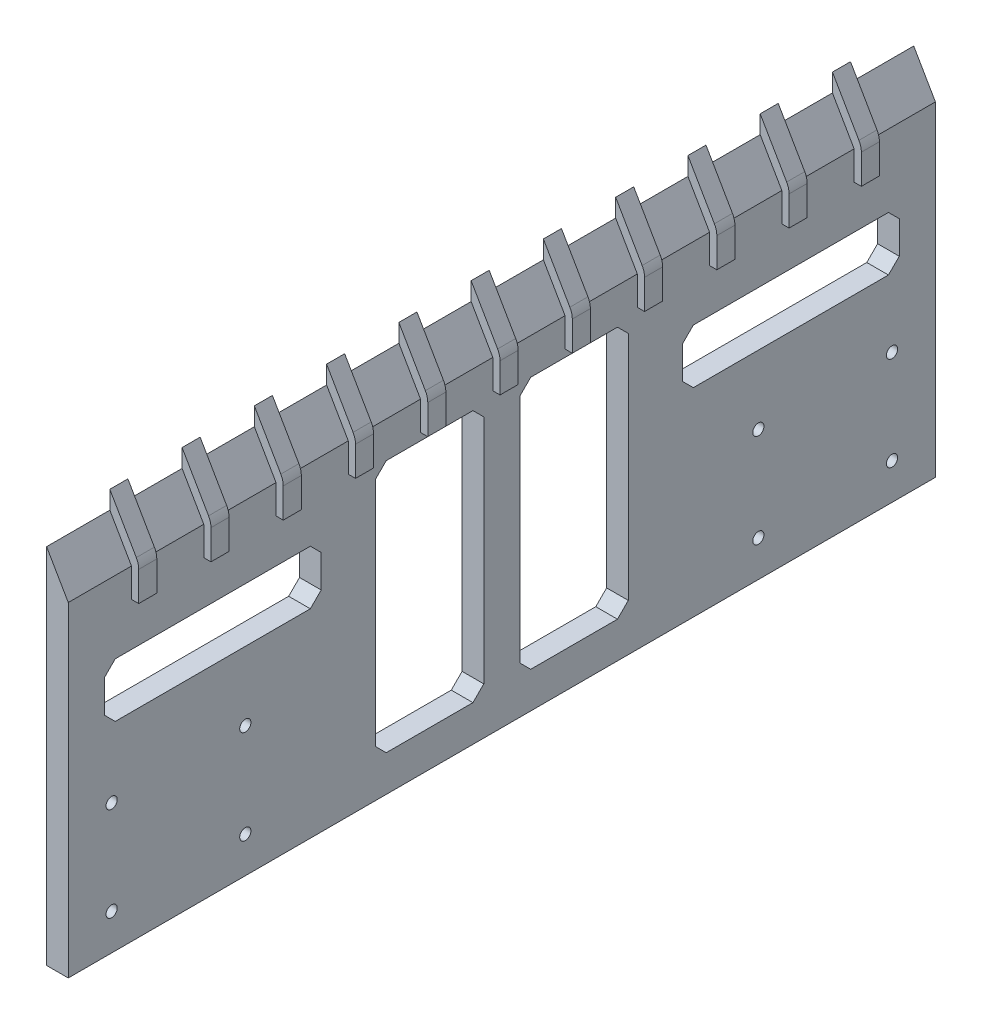
from build123d import *

# Parameters (mm, degrees)
SKETCH_1_W                  = 240
SKETCH_1_H                  = 90
EXTRUDE_1_DEPTH             = 6
SKETCH_2_R                  = 1.55
CUT_EXTRUDE_1_DEPTH         = 257.390327431
SKETCH_3_W                  = 60
SKETCH_3_H                  = 15
CUT_EXTRUDE_2_DEPTH         = 257.390327431
SKETCH_4_W                  = 30
SKETCH_4_H                  = 70
CUT_EXTRUDE_3_DEPTH         = 257.390327431
SKETCH_5_R                  = 3
CUT_EXTRUDE_4_DEPTH         = 3
EXTRUDE_2_DEPTH             = 240
EXTRUDE_3_DEPTH             = 5
PATTERN_LINEAR_5_COUNT      = 6
PATTERN_LINEAR_5_PITCH      = 20
PATTERN_LINEAR_5_COUNT_DIR2 = 6
PATTERN_LINEAR_5_PITCH_DIR2 = 20
FILLET_5_R                  = 5
CHAMFER_1_SIZE              = 3


with BuildPart() as part:
    # 草图1 → 凸台-拉伸1 (new body)
    with BuildSketch(Plane(origin=(0, 0, 0), x_dir=(0, 0, -1), z_dir=(1, 0, 0))):
        with Locations((120, -45)):
            Rectangle(SKETCH_1_W, SKETCH_1_H)
    extrude(amount=EXTRUDE_1_DEPTH)

    # 草图2 → 切除-拉伸1 (cut, through all)
    with BuildSketch(Plane(origin=(6, 0, 0), x_dir=(0, 0, -1), z_dir=(1, 0, 0))):
        with Locations((12, -54)):
            Circle(SKETCH_2_R)
        with Locations((49, -80)):
            Circle(SKETCH_2_R)
        with Locations((49, -54)):
            Circle(SKETCH_2_R)
        with Locations((12, -80)):
            Circle(SKETCH_2_R)
        with Locations((228, -80)):
            Circle(SKETCH_2_R)
        with Locations((191, -54)):
            Circle(SKETCH_2_R)
        with Locations((191, -80)):
            Circle(SKETCH_2_R)
        with Locations((228, -54)):
            Circle(SKETCH_2_R)
    extrude(amount=-CUT_EXTRUDE_1_DEPTH, mode=Mode.SUBTRACT)

    # 草图3 → 切除-拉伸2 (cut, through all)
    with BuildSketch(Plane(origin=(6, 0, 0), x_dir=(0, 0, -1), z_dir=(1, 0, 0))):
        with Locations((40, -27.5)):
            Rectangle(SKETCH_3_W, SKETCH_3_H)
        with Locations((200, -27.5)):
            Rectangle(SKETCH_3_W, SKETCH_3_H)
    extrude(amount=-CUT_EXTRUDE_2_DEPTH, mode=Mode.SUBTRACT)

    # 草图4 → 切除-拉伸3 (cut, through all)
    with BuildSketch(Plane(origin=(6, 0, 0), x_dir=(0, 0, -1), z_dir=(1, 0, 0))):
        with Locations((100, -45)):
            Rectangle(SKETCH_4_W, SKETCH_4_H)
        with Locations((140, -45)):
            Rectangle(SKETCH_4_W, SKETCH_4_H)
    extrude(amount=-CUT_EXTRUDE_3_DEPTH, mode=Mode.SUBTRACT)

    # 草图5 → 切除-拉伸4 (cut)
    with BuildSketch(Plane.ZY):
        with Locations((-191, -80)):
            Circle(SKETCH_5_R)
        with Locations((-228, -80)):
            Circle(SKETCH_5_R)
        with Locations((-191, -54)):
            Circle(SKETCH_5_R)
        with Locations((-228, -54)):
            Circle(SKETCH_5_R)
        with Locations((-45, -80)):
            Circle(SKETCH_5_R)
        with Locations((-12, -80)):
            Circle(SKETCH_5_R)
        with Locations((-12, -54)):
            Circle(SKETCH_5_R)
        with Locations((-49, -54)):
            Circle(SKETCH_5_R)
    extrude(amount=-CUT_EXTRUDE_4_DEPTH, mode=Mode.SUBTRACT)

    # 草图6 → 凸台-拉伸2 (add)
    with BuildSketch(Plane.XY):
        Polygon((6, 0), (0, 0), (0, 10.392304845), align=None)
    extrude(amount=-EXTRUDE_2_DEPTH)

    # 草图7 → 凸台-拉伸3 (add)
    with BuildSketch(Plane.XY.offset(-117.5)):
        Polygon((0, 10.392304845), (0, 15.392304845), (8, 1.535898385), (8, -8), (6, -8), (6, 0), align=None)
    extrude_3 = extrude(amount=-EXTRUDE_3_DEPTH)

    # 阵列(线性)5: Extrude 3 6 × 6
    with Locations(*[Vector(0, 0, 1) * (i * PATTERN_LINEAR_5_PITCH) + Vector(0, 0, -1) * (j * PATTERN_LINEAR_5_PITCH_DIR2) for i in range(PATTERN_LINEAR_5_COUNT) for j in range(PATTERN_LINEAR_5_COUNT_DIR2) if (i, j) != (0, 0)]):
        add(extrude_3)

    # 圆角5
    fillet_5_edges = [part.edges().sort_by_distance(p)[0] for p in [
        (8, 1.535898385, -20),
        (8, 1.535898385, -40),
        (8, 1.535898385, -60),
        (8, 1.535898385, -80),
        (8, 1.535898385, -100),
        (8, 1.535898385, -120),
        (8, 1.535898385, -140),
        (8, 1.535898385, -160),
        (8, 1.535898385, -180),
        (8, 1.535898385, -200),
        (8, 1.535898385, -220),
    ]]
    fillet(fillet_5_edges, radius=FILLET_5_R)

    # 倒角1
    chamfer_1_edges = [part.edges().sort_by_distance(p)[0] for p in [
        (3, -80, -85),
        (3, -80, -125),
        (3, -35, -170),
        (3, -35, -230),
        (3, -80, -155),
        (3, -80, -115),
        (3, -20, -230),
        (3, -10, -155),
        (3, -10, -115),
        (3, -20, -170),
        (3, -10, -125),
        (3, -10, -85),
        (3, -35, -70),
        (3, -20, -70),
        (3, -35, -10),
        (3, -20, -10),
    ]]
    chamfer(chamfer_1_edges, length=CHAMFER_1_SIZE)


solid = part.part
